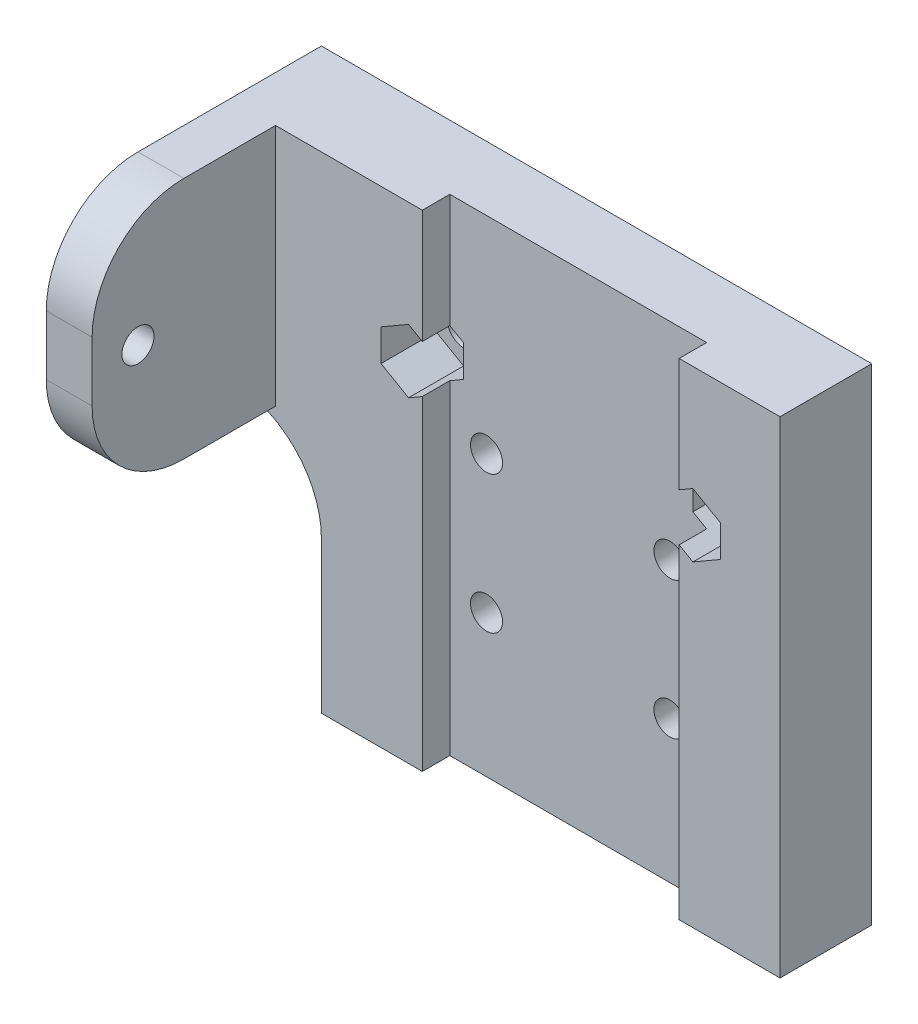
from build123d import *

# Parameters (mm, degrees)
SKETCH_1_W          = 50
SKETCH_1_H          = 53
SKETCH_1_R          = 1.75
EXTRUDE_1_DEPTH     = 10
SKETCH_2_W          = 28
SKETCH_2_H          = 53
CUT_EXTRUDE_1_DEPTH = 3
CUT_EXTRUDE_2_DEPTH = 6
SKETCH_5_R          = 3
CUT_EXTRUDE_4_DEPTH = 3.2
SKETCH_6_W          = 10
SKETCH_6_H          = 26.5
EXTRUDE_2_DEPTH     = 30
SKETCH_7_W          = 5
SKETCH_7_H          = 26.5
CUT_EXTRUDE_5_DEPTH = 20
FILLET_2_R          = 10
FILLET_3_R          = 10
SKETCH_8_R          = 1.75
CUT_EXTRUDE_6_DEPTH = 20


with BuildPart() as part:
    # 草图1 → 凸台-拉伸1 (new body)
    with BuildSketch(Plane.XY):
        with Locations((25, -26.5)):
            Rectangle(SKETCH_1_W, SKETCH_1_H)
        with Locations((35, -22.5)):
            Circle(SKETCH_1_R, mode=Mode.SUBTRACT)
        with Locations((40.5, -15)):
            Circle(SKETCH_1_R, mode=Mode.SUBTRACT)
        with Locations((35, -37.5)):
            Circle(SKETCH_1_R, mode=Mode.SUBTRACT)
        with Locations(Location((15, -37.5, 0), (0, 0, 180))):
            Circle(SKETCH_1_R, mode=Mode.SUBTRACT)
        with Locations(Location((15, -22.5, 0), (0, 0, 180))):
            Circle(SKETCH_1_R, mode=Mode.SUBTRACT)
        with Locations(Location((9.5, -15, 0), (0, 0, 180))):
            Circle(SKETCH_1_R, mode=Mode.SUBTRACT)
    extrude(amount=EXTRUDE_1_DEPTH)

    # 草图2 → 切除-拉伸1 (cut)
    with BuildSketch(Plane.XY.offset(10)):
        with Locations((25, -26.5)):
            Rectangle(SKETCH_2_W, SKETCH_2_H)
    extrude(amount=-CUT_EXTRUDE_1_DEPTH, mode=Mode.SUBTRACT)

    # 草图3 → 切除-拉伸2 (cut)
    with BuildSketch(Plane.XY.offset(10)):
        Polygon((9.5, -18.464101615), (12.5, -16.732050808), (12.5, -13.267949192), (9.5, -11.535898385), (6.5, -13.267949192), (6.5, -16.732050808), align=None)
        Polygon((40.5, -18.464101615), (43.5, -16.732050808), (43.5, -13.267949192), (40.5, -11.535898385), (37.5, -13.267949192), (37.5, -16.732050808), align=None)
    extrude(amount=-CUT_EXTRUDE_2_DEPTH, mode=Mode.SUBTRACT)

    # 草图5 → 切除-拉伸4 (cut)
    with BuildSketch(Plane(origin=(0, 0, 0), x_dir=(-1, 0, 0), z_dir=(0, 0, -1))):
        with Locations((-35, -37.5)):
            Circle(SKETCH_5_R)
        with Locations((-35, -22.5)):
            Circle(SKETCH_5_R)
        with Locations((-15, -37.5)):
            Circle(SKETCH_5_R)
        with Locations((-15, -22.5)):
            Circle(SKETCH_5_R)
    extrude(amount=-CUT_EXTRUDE_4_DEPTH, mode=Mode.SUBTRACT)

    # 草图6 → 凸台-拉伸2 (add)
    with BuildSketch(Plane(origin=(0, 0, 0), x_dir=(-1, 0, 0), z_dir=(0, 0, -1))):
        with Locations((5, -13.25)):
            Rectangle(SKETCH_6_W, SKETCH_6_H)
    extrude(amount=-EXTRUDE_2_DEPTH)

    # 草图7 → 切除-拉伸5 (cut)
    with BuildSketch(Plane.XY.offset(30)):
        with Locations((-2.5, -13.25)):
            Rectangle(SKETCH_7_W, SKETCH_7_H)
    extrude(amount=-CUT_EXTRUDE_5_DEPTH, mode=Mode.SUBTRACT)

    # 圆角2
    fillet_2_edges = [part.edges().sort_by_distance(p)[0] for p in [
        (-7.5, 0, 30),
        (-7.5, -26.5, 30),
    ]]
    fillet(fillet_2_edges, radius=FILLET_2_R)

    # 圆角3
    # the kernel refuses this fillet: 10 mm, written as the material it adds along each edge
    with BuildSketch(Plane(origin=(0, -26.5, 0), x_dir=(-1, 0, 0), z_dir=(0, 0, 1))) as fillet_3_piece_1:
        with BuildLine():
            CenterArc((FILLET_3_R, FILLET_3_R), FILLET_3_R, 180, 90)
            Line((0, FILLET_3_R), (0, 0))
            Line((0, 0), (FILLET_3_R, 0))
        make_face()
    extrude(amount=10)

    # 草图8 → 切除-拉伸6 (cut)
    with BuildSketch(Plane(origin=(-5, 0, 0), x_dir=(0, 0, -1), z_dir=(1, 0, 0))):
        with Locations((-25, -13.25)):
            Circle(SKETCH_8_R)
    extrude(amount=-CUT_EXTRUDE_6_DEPTH, mode=Mode.SUBTRACT)


solid = part.part
